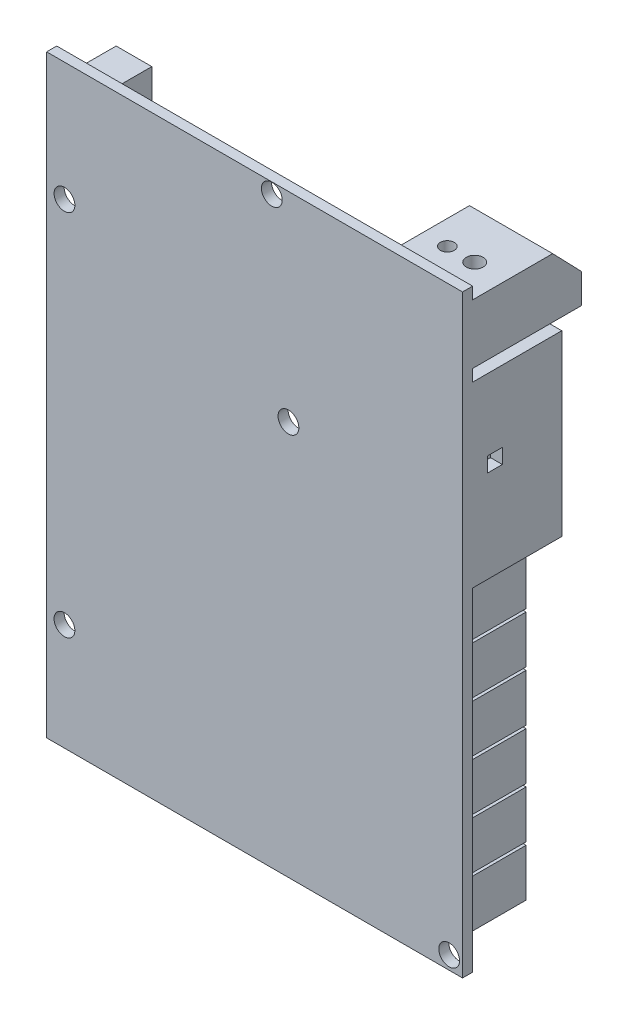
from build123d import *

# Parameters (mm, degrees)
SKETCH1_W                  = 70
SKETCH1_H                  = 100
BOSS_EXTRUDE1_DEPTH        = 1.7
SKETCH2_W                  = 6
SKETCH2_H                  = 8
BOSS_EXTRUDE2_DEPTH        = 10
SKETCH3_W                  = 5
SKETCH3_H                  = 7
CUT_EXTRUDE1_DEPTH         = 9.5
SKETCH4_W                  = 0.5
SKETCH4_H                  = 0.7
BOSS_EXTRUDE3_DEPTH        = 8.5
SKETCH5_W                  = 0.5
SKETCH5_H                  = 0.7
BOSS_EXTRUDE4_DEPTH        = 8.5
SKETCH6_W                  = 6
SKETCH6_H                  = 13
BOSS_EXTRUDE5_DEPTH        = 9
SKETCH7_W                  = 5
SKETCH7_H                  = 12
CUT_EXTRUDE2_DEPTH         = 8.5
SKETCH8_W                  = 0.5
SKETCH8_H                  = 0.7
BOSS_EXTRUDE6_DEPTH        = 7.5
SKETCH9_W                  = 0.5
SKETCH9_H                  = 0.7
BOSS_EXTRUDE7_DEPTH        = 7.5
SKETCH10_W                 = 0.5
SKETCH10_H                 = 0.7
BOSS_EXTRUDE8_DEPTH        = 7.5
SKETCH11_W                 = 0.5
SKETCH11_H                 = 0.7
BOSS_EXTRUDE9_DEPTH        = 7.5
SKETCH12_W                 = 6
SKETCH12_H                 = 8
BOSS_EXTRUDE10_DEPTH       = 10
SKETCH13_W                 = 5
SKETCH13_H                 = 7
CUT_EXTRUDE3_DEPTH         = 9.5
SKETCH14_W                 = 0.5
SKETCH14_H                 = 0.7
BOSS_EXTRUDE11_DEPTH       = 8.5
SKETCH15_W                 = 0.5
SKETCH15_H                 = 0.7
BOSS_EXTRUDE12_DEPTH       = 8.5
SKETCH16_W                 = 6
SKETCH16_H                 = 8
BOSS_EXTRUDE13_DEPTH       = 10
SKETCH17_W                 = 5
SKETCH17_H                 = 7
CUT_EXTRUDE4_DEPTH         = 9.5
SKETCH18_W                 = 0.5
SKETCH18_H                 = 0.7
BOSS_EXTRUDE14_DEPTH       = 8.5
SKETCH19_W                 = 0.5
SKETCH19_H                 = 0.7
BOSS_EXTRUDE15_DEPTH       = 8.5
SKETCH20_W                 = 6
SKETCH20_H                 = 13
BOSS_EXTRUDE16_DEPTH       = 9
SKETCH21_W                 = 5
SKETCH21_H                 = 12
CUT_EXTRUDE5_DEPTH         = 8.5
SKETCH22_W                 = 0.5
SKETCH22_H                 = 0.7
BOSS_EXTRUDE17_DEPTH       = 7.5
SKETCH23_W                 = 0.5
SKETCH23_H                 = 0.7
BOSS_EXTRUDE18_DEPTH       = 7.5
SKETCH24_W                 = 0.5
SKETCH24_H                 = 0.7
BOSS_EXTRUDE19_DEPTH       = 7.5
SKETCH25_W                 = 0.5
SKETCH25_H                 = 0.7
BOSS_EXTRUDE20_DEPTH       = 7.5
SKETCH26_W                 = 6
SKETCH26_H                 = 8
BOSS_EXTRUDE21_DEPTH       = 10
SKETCH27_W                 = 5
SKETCH27_H                 = 7
CUT_EXTRUDE6_DEPTH         = 9.5
SKETCH28_W                 = 0.5
SKETCH28_H                 = 0.7
BOSS_EXTRUDE22_DEPTH       = 8.5
SKETCH29_W                 = 0.5
SKETCH29_H                 = 0.7
BOSS_EXTRUDE23_DEPTH       = 8.5
SKETCH30_W                 = 6
SKETCH30_H                 = 8
BOSS_EXTRUDE24_DEPTH       = 10
SKETCH31_W                 = 5
SKETCH31_H                 = 7
CUT_EXTRUDE7_DEPTH         = 9.5
SKETCH32_W                 = 0.5
SKETCH32_H                 = 0.7
BOSS_EXTRUDE25_DEPTH       = 8.5
SKETCH33_W                 = 0.5
SKETCH33_H                 = 0.7
BOSS_EXTRUDE26_DEPTH       = 8.5
SKETCH34_W                 = 6
SKETCH34_H                 = 13
BOSS_EXTRUDE27_DEPTH       = 9
SKETCH35_W                 = 5
SKETCH35_H                 = 12
CUT_EXTRUDE8_DEPTH         = 8.5
SKETCH36_W                 = 0.5
SKETCH36_H                 = 0.7
BOSS_EXTRUDE28_DEPTH       = 7.5
SKETCH37_W                 = 0.5
SKETCH37_H                 = 0.7
BOSS_EXTRUDE29_DEPTH       = 7.5
SKETCH38_W                 = 0.5
SKETCH38_H                 = 0.7
BOSS_EXTRUDE30_DEPTH       = 7.5
SKETCH39_W                 = 0.5
SKETCH39_H                 = 0.7
BOSS_EXTRUDE31_DEPTH       = 7.5
SKETCH40_W                 = 6
SKETCH40_H                 = 8
BOSS_EXTRUDE32_DEPTH       = 10
SKETCH41_W                 = 5
SKETCH41_H                 = 7
CUT_EXTRUDE9_DEPTH         = 9.5
SKETCH42_W                 = 0.5
SKETCH42_H                 = 0.7
BOSS_EXTRUDE33_DEPTH       = 8.59367
SKETCH43_W                 = 0.5
SKETCH43_H                 = 0.7
BOSS_EXTRUDE34_DEPTH       = 8.59367
SKETCH44_W                 = 6
SKETCH44_H                 = 13
BOSS_EXTRUDE35_DEPTH       = 9
SKETCH45_W                 = 5
SKETCH45_H                 = 12
CUT_EXTRUDE10_DEPTH        = 8.5
SKETCH46_W                 = 0.5
SKETCH46_H                 = 0.7
BOSS_EXTRUDE36_DEPTH       = 7.5
SKETCH47_W                 = 0.5
SKETCH47_H                 = 0.7
BOSS_EXTRUDE37_DEPTH       = 7.5
SKETCH48_W                 = 0.5
SKETCH48_H                 = 0.7
BOSS_EXTRUDE38_DEPTH       = 7.5
SKETCH49_W                 = 0.5
SKETCH49_H                 = 0.7
BOSS_EXTRUDE39_DEPTH       = 7.5
SKETCH50_W                 = 6
SKETCH50_H                 = 8
BOSS_EXTRUDE40_DEPTH       = 10
SKETCH51_W                 = 5
SKETCH51_H                 = 7
CUT_EXTRUDE11_DEPTH        = 9.5
SKETCH52_W                 = 0.5
SKETCH52_H                 = 0.7
BOSS_EXTRUDE41_DEPTH       = 8.5
SKETCH53_W                 = 0.5
SKETCH53_H                 = 0.7
BOSS_EXTRUDE42_DEPTH       = 8.5
SKETCH54_W                 = 20
SKETCH54_H                 = 10
BOSS_EXTRUDE43_DEPTH       = 10
SKETCH55_W                 = 19
SKETCH55_H                 = 9
CUT_EXTRUDE12_DEPTH        = 9.5
SKETCH56_W                 = 0.5
SKETCH56_H                 = 0.7
BOSS_EXTRUDE44_DEPTH       = 8.59367
SKETCH57_W                 = 0.5
SKETCH57_H                 = 0.7
BOSS_EXTRUDE45_DEPTH       = 8.59367
SKETCH58_W                 = 0.5
SKETCH58_H                 = 0.7
BOSS_EXTRUDE46_DEPTH       = 8.59367
SKETCH59_W                 = 0.5
SKETCH59_H                 = 0.7
BOSS_EXTRUDE47_DEPTH       = 8.59367
SKETCH60_W                 = 0.5
SKETCH60_H                 = 0.7
BOSS_EXTRUDE48_DEPTH       = 8.59367
SKETCH61_W                 = 0.5
SKETCH61_H                 = 0.7
BOSS_EXTRUDE49_DEPTH       = 8.59367
SKETCH62_W                 = 0.5
SKETCH62_H                 = 0.7
BOSS_EXTRUDE50_DEPTH       = 8.59367
SKETCH63_W                 = 0.5
SKETCH63_H                 = 0.7
BOSS_EXTRUDE51_DEPTH       = 8.59367
SKETCH64_W                 = 0.5
SKETCH64_H                 = 0.7
BOSS_EXTRUDE52_DEPTH       = 8.59367
SKETCH65_W                 = 0.5
SKETCH65_H                 = 0.7
BOSS_EXTRUDE53_DEPTH       = 8.59367
SKETCH66_W                 = 8
SKETCH66_H                 = 10
BOSS_EXTRUDE54_DEPTH       = 4.1
SKETCH67_W                 = 7
SKETCH67_H                 = 2.6
CUT_EXTRUDE13_DEPTH        = 9.5
SKETCH68_W                 = 15
SKETCH68_H                 = 15
BOSS_EXTRUDE55_DEPTH       = 1.9
SKETCH69_W                 = 14
SKETCH69_H                 = 0.5
CUT_EXTRUDE14_DEPTH        = 14.5
BOSS_EXTRUDE56_DEPTH       = 14
SKETCH71_W                 = 10
SKETCH71_H                 = 30
BOSS_EXTRUDE57_DEPTH       = 15
SKETCH72_W                 = 2.5
SKETCH72_H                 = 2.5
CUT_EXTRUDE15_DEPTH        = 2
F_3_5_3_5_DIAMETER_HOLE1_D = 3.5
M2_CLEARANCE_HOLE1_D       = 2.347782271
M2_CLEARANCE_HOLE1_DEPTH   = 5
M2_5_CLEARANCE_HOLE1_D     = 2.850878472
M2_5_CLEARANCE_HOLE1_DEPTH = 5


with BuildPart() as part:
    # Sketch1 → Boss-Extrude1 (new body)
    with BuildSketch(Plane(origin=(0, 0, -40), x_dir=(-1, 0, 0), z_dir=(0, 0, -1))):
        with Locations((-16.2, -111.8)):
            Rectangle(SKETCH1_W, SKETCH1_H)
    extrude(amount=-BOSS_EXTRUDE1_DEPTH)

    # Sketch2 → Boss-Extrude2 (add)
    with BuildSketch(Plane(origin=(0, 0, -40), x_dir=(-1, 0, 0), z_dir=(0, 0, -1))):
        with Locations((-47.2, -110.3)):
            Rectangle(SKETCH2_W, SKETCH2_H)
    extrude(amount=BOSS_EXTRUDE2_DEPTH)

    # Sketch3 → Cut-Extrude1 (cut)
    with BuildSketch(Plane(origin=(0, 0, -50), x_dir=(-1, 0, 0), z_dir=(0, 0, -1))):
        with Locations((-47.2, -110.3)):
            Rectangle(SKETCH3_W, SKETCH3_H)
    extrude(amount=-CUT_EXTRUDE1_DEPTH, mode=Mode.SUBTRACT)

    # Sketch4 → Boss-Extrude3 (add)
    with BuildSketch(Plane(origin=(0, 0, -40.5), x_dir=(-1, 0, 0), z_dir=(0, 0, -1))):
        with Locations((-47.45, -111.9)):
            Rectangle(SKETCH4_W, SKETCH4_H)
    extrude(amount=BOSS_EXTRUDE3_DEPTH)

    # Sketch5 → Boss-Extrude4 (add)
    with BuildSketch(Plane(origin=(0, 0, -40.5), x_dir=(-1, 0, 0), z_dir=(0, 0, -1))):
        with Locations((-47.45, -108.7)):
            Rectangle(SKETCH5_W, SKETCH5_H)
    extrude(amount=BOSS_EXTRUDE4_DEPTH)

    # Sketch6 → Boss-Extrude5 (add)
    with BuildSketch(Plane(origin=(0, 0, -40), x_dir=(-1, 0, 0), z_dir=(0, 0, -1))):
        with Locations((14.8, -72.3)):
            Rectangle(SKETCH6_W, SKETCH6_H)
    extrude(amount=BOSS_EXTRUDE5_DEPTH)

    # Sketch7 → Cut-Extrude2 (cut)
    with BuildSketch(Plane(origin=(0, 0, -49), x_dir=(-1, 0, 0), z_dir=(0, 0, -1))):
        with Locations((14.8, -72.3)):
            Rectangle(SKETCH7_W, SKETCH7_H)
    extrude(amount=-CUT_EXTRUDE2_DEPTH, mode=Mode.SUBTRACT)

    # Sketch8 → Boss-Extrude6 (add)
    with BuildSketch(Plane(origin=(0, 0, -40.5), x_dir=(-1, 0, 0), z_dir=(0, 0, -1))):
        with Locations((14.55, -75.9)):
            Rectangle(SKETCH8_W, SKETCH8_H)
    extrude(amount=BOSS_EXTRUDE6_DEPTH)

    # Sketch9 → Boss-Extrude7 (add)
    with BuildSketch(Plane(origin=(0, 0, -40.5), x_dir=(-1, 0, 0), z_dir=(0, 0, -1))):
        with Locations((14.55, -68.4)):
            Rectangle(SKETCH9_W, SKETCH9_H)
    extrude(amount=BOSS_EXTRUDE7_DEPTH)

    # Sketch10 → Boss-Extrude8 (add)
    with BuildSketch(Plane(origin=(0, 0, -40.5), x_dir=(-1, 0, 0), z_dir=(0, 0, -1))):
        with Locations((14.55, -70.9)):
            Rectangle(SKETCH10_W, SKETCH10_H)
    extrude(amount=BOSS_EXTRUDE8_DEPTH)

    # Sketch11 → Boss-Extrude9 (add)
    with BuildSketch(Plane(origin=(0, 0, -40.5), x_dir=(-1, 0, 0), z_dir=(0, 0, -1))):
        with Locations((14.55, -73.4)):
            Rectangle(SKETCH11_W, SKETCH11_H)
    extrude(amount=BOSS_EXTRUDE9_DEPTH)

    # Sketch12 → Boss-Extrude10 (add)
    with BuildSketch(Plane(origin=(0, 0, -40), x_dir=(-1, 0, 0), z_dir=(0, 0, -1))):
        with Locations((-47.2, -135.8)):
            Rectangle(SKETCH12_W, SKETCH12_H)
    extrude(amount=BOSS_EXTRUDE10_DEPTH)

    # Sketch13 → Cut-Extrude3 (cut)
    with BuildSketch(Plane(origin=(0, 0, -50), x_dir=(-1, 0, 0), z_dir=(0, 0, -1))):
        with Locations((-47.2, -135.8)):
            Rectangle(SKETCH13_W, SKETCH13_H)
    extrude(amount=-CUT_EXTRUDE3_DEPTH, mode=Mode.SUBTRACT)

    # Sketch14 → Boss-Extrude11 (add)
    with BuildSketch(Plane(origin=(0, 0, -40.5), x_dir=(-1, 0, 0), z_dir=(0, 0, -1))):
        with Locations((-47.45, -134.2)):
            Rectangle(SKETCH14_W, SKETCH14_H)
    extrude(amount=BOSS_EXTRUDE11_DEPTH)

    # Sketch15 → Boss-Extrude12 (add)
    with BuildSketch(Plane(origin=(0, 0, -40.5), x_dir=(-1, 0, 0), z_dir=(0, 0, -1))):
        with Locations((-47.45, -137.4)):
            Rectangle(SKETCH15_W, SKETCH15_H)
    extrude(amount=BOSS_EXTRUDE12_DEPTH)

    # Sketch16 → Boss-Extrude13 (add)
    with BuildSketch(Plane(origin=(0, 0, -40), x_dir=(-1, 0, 0), z_dir=(0, 0, -1))):
        with Locations((-47.2, -127.3)):
            Rectangle(SKETCH16_W, SKETCH16_H)
    extrude(amount=BOSS_EXTRUDE13_DEPTH)

    # Sketch17 → Cut-Extrude4 (cut)
    with BuildSketch(Plane(origin=(0, 0, -50), x_dir=(-1, 0, 0), z_dir=(0, 0, -1))):
        with Locations((-47.2, -127.3)):
            Rectangle(SKETCH17_W, SKETCH17_H)
    extrude(amount=-CUT_EXTRUDE4_DEPTH, mode=Mode.SUBTRACT)

    # Sketch18 → Boss-Extrude14 (add)
    with BuildSketch(Plane(origin=(0, 0, -40.5), x_dir=(-1, 0, 0), z_dir=(0, 0, -1))):
        with Locations((-47.45, -125.7)):
            Rectangle(SKETCH18_W, SKETCH18_H)
    extrude(amount=BOSS_EXTRUDE14_DEPTH)

    # Sketch19 → Boss-Extrude15 (add)
    with BuildSketch(Plane(origin=(0, 0, -40.5), x_dir=(-1, 0, 0), z_dir=(0, 0, -1))):
        with Locations((-47.45, -128.9)):
            Rectangle(SKETCH19_W, SKETCH19_H)
    extrude(amount=BOSS_EXTRUDE15_DEPTH)

    # Sketch20 → Boss-Extrude16 (add)
    with BuildSketch(Plane(origin=(0, 0, -40), x_dir=(-1, 0, 0), z_dir=(0, 0, -1))):
        with Locations((14.8, -114.3)):
            Rectangle(SKETCH20_W, SKETCH20_H)
    extrude(amount=BOSS_EXTRUDE16_DEPTH)

    # Sketch21 → Cut-Extrude5 (cut)
    with BuildSketch(Plane(origin=(0, 0, -49), x_dir=(-1, 0, 0), z_dir=(0, 0, -1))):
        with Locations((14.8, -114.3)):
            Rectangle(SKETCH21_W, SKETCH21_H)
    extrude(amount=-CUT_EXTRUDE5_DEPTH, mode=Mode.SUBTRACT)

    # Sketch22 → Boss-Extrude17 (add)
    with BuildSketch(Plane(origin=(0, 0, -40.5), x_dir=(-1, 0, 0), z_dir=(0, 0, -1))):
        with Locations((14.55, -117.9)):
            Rectangle(SKETCH22_W, SKETCH22_H)
    extrude(amount=BOSS_EXTRUDE17_DEPTH)

    # Sketch23 → Boss-Extrude18 (add)
    with BuildSketch(Plane(origin=(0, 0, -40.5), x_dir=(-1, 0, 0), z_dir=(0, 0, -1))):
        with Locations((14.55, -115.4)):
            Rectangle(SKETCH23_W, SKETCH23_H)
    extrude(amount=BOSS_EXTRUDE18_DEPTH)

    # Sketch24 → Boss-Extrude19 (add)
    with BuildSketch(Plane(origin=(0, 0, -40.5), x_dir=(-1, 0, 0), z_dir=(0, 0, -1))):
        with Locations((14.55, -112.9)):
            Rectangle(SKETCH24_W, SKETCH24_H)
    extrude(amount=BOSS_EXTRUDE19_DEPTH)

    # Sketch25 → Boss-Extrude20 (add)
    with BuildSketch(Plane(origin=(0, 0, -40.5), x_dir=(-1, 0, 0), z_dir=(0, 0, -1))):
        with Locations((14.55, -110.4)):
            Rectangle(SKETCH25_W, SKETCH25_H)
    extrude(amount=BOSS_EXTRUDE20_DEPTH)

    # Sketch26 → Boss-Extrude21 (add)
    with BuildSketch(Plane(origin=(0, 0, -40), x_dir=(-1, 0, 0), z_dir=(0, 0, -1))):
        with Locations((-39.2, -113.3)):
            Rectangle(SKETCH26_W, SKETCH26_H)
    extrude(amount=BOSS_EXTRUDE21_DEPTH)

    # Sketch27 → Cut-Extrude6 (cut)
    with BuildSketch(Plane(origin=(0, 0, -50), x_dir=(-1, 0, 0), z_dir=(0, 0, -1))):
        with Locations((-39.2, -113.3)):
            Rectangle(SKETCH27_W, SKETCH27_H)
    extrude(amount=-CUT_EXTRUDE6_DEPTH, mode=Mode.SUBTRACT)

    # Sketch28 → Boss-Extrude22 (add)
    with BuildSketch(Plane(origin=(0, 0, -40.5), x_dir=(-1, 0, 0), z_dir=(0, 0, -1))):
        with Locations((-39.45, -111.7)):
            Rectangle(SKETCH28_W, SKETCH28_H)
    extrude(amount=BOSS_EXTRUDE22_DEPTH)

    # Sketch29 → Boss-Extrude23 (add)
    with BuildSketch(Plane(origin=(0, 0, -40.5), x_dir=(-1, 0, 0), z_dir=(0, 0, -1))):
        with Locations((-39.45, -114.9)):
            Rectangle(SKETCH29_W, SKETCH29_H)
    extrude(amount=BOSS_EXTRUDE23_DEPTH)

    # Sketch30 → Boss-Extrude24 (add)
    with BuildSketch(Plane(origin=(0, 0, -40), x_dir=(-1, 0, 0), z_dir=(0, 0, -1))):
        with Locations((-47.2, -144.3)):
            Rectangle(SKETCH30_W, SKETCH30_H)
    extrude(amount=BOSS_EXTRUDE24_DEPTH)

    # Sketch31 → Cut-Extrude7 (cut)
    with BuildSketch(Plane(origin=(0, 0, -50), x_dir=(-1, 0, 0), z_dir=(0, 0, -1))):
        with Locations((-47.2, -144.3)):
            Rectangle(SKETCH31_W, SKETCH31_H)
    extrude(amount=-CUT_EXTRUDE7_DEPTH, mode=Mode.SUBTRACT)

    # Sketch32 → Boss-Extrude25 (add)
    with BuildSketch(Plane(origin=(0, 0, -40.5), x_dir=(-1, 0, 0), z_dir=(0, 0, -1))):
        with Locations((-47.45, -142.7)):
            Rectangle(SKETCH32_W, SKETCH32_H)
    extrude(amount=BOSS_EXTRUDE25_DEPTH)

    # Sketch33 → Boss-Extrude26 (add)
    with BuildSketch(Plane(origin=(0, 0, -40.5), x_dir=(-1, 0, 0), z_dir=(0, 0, -1))):
        with Locations((-47.45, -145.9)):
            Rectangle(SKETCH33_W, SKETCH33_H)
    extrude(amount=BOSS_EXTRUDE26_DEPTH)

    # Sketch34 → Boss-Extrude27 (add)
    with BuildSketch(Plane(origin=(0, 0, -40), x_dir=(-1, 0, 0), z_dir=(0, 0, -1))):
        with Locations((14.8, -132.3)):
            Rectangle(SKETCH34_W, SKETCH34_H)
    extrude(amount=BOSS_EXTRUDE27_DEPTH)

    # Sketch35 → Cut-Extrude8 (cut)
    with BuildSketch(Plane(origin=(0, 0, -49), x_dir=(-1, 0, 0), z_dir=(0, 0, -1))):
        with Locations((14.8, -132.3)):
            Rectangle(SKETCH35_W, SKETCH35_H)
    extrude(amount=-CUT_EXTRUDE8_DEPTH, mode=Mode.SUBTRACT)

    # Sketch36 → Boss-Extrude28 (add)
    with BuildSketch(Plane(origin=(0, 0, -40.5), x_dir=(-1, 0, 0), z_dir=(0, 0, -1))):
        with Locations((14.55, -128.4)):
            Rectangle(SKETCH36_W, SKETCH36_H)
    extrude(amount=BOSS_EXTRUDE28_DEPTH)

    # Sketch37 → Boss-Extrude29 (add)
    with BuildSketch(Plane(origin=(0, 0, -40.5), x_dir=(-1, 0, 0), z_dir=(0, 0, -1))):
        with Locations((14.55, -135.9)):
            Rectangle(SKETCH37_W, SKETCH37_H)
    extrude(amount=BOSS_EXTRUDE29_DEPTH)

    # Sketch38 → Boss-Extrude30 (add)
    with BuildSketch(Plane(origin=(0, 0, -40.5), x_dir=(-1, 0, 0), z_dir=(0, 0, -1))):
        with Locations((14.55, -133.4)):
            Rectangle(SKETCH38_W, SKETCH38_H)
    extrude(amount=BOSS_EXTRUDE30_DEPTH)

    # Sketch39 → Boss-Extrude31 (add)
    with BuildSketch(Plane(origin=(0, 0, -40.5), x_dir=(-1, 0, 0), z_dir=(0, 0, -1))):
        with Locations((14.55, -130.9)):
            Rectangle(SKETCH39_W, SKETCH39_H)
    extrude(amount=BOSS_EXTRUDE31_DEPTH)

    # Sketch40 → Boss-Extrude32 (add)
    with BuildSketch(Plane(origin=(0, 0, -40), x_dir=(-1, 0, 0), z_dir=(0, 0, -1))):
        with Locations((-47.2, -152.8)):
            Rectangle(SKETCH40_W, SKETCH40_H)
    extrude(amount=BOSS_EXTRUDE32_DEPTH)

    # Sketch41 → Cut-Extrude9 (cut)
    with BuildSketch(Plane(origin=(0, 0, -50), x_dir=(-1, 0, 0), z_dir=(0, 0, -1))):
        with Locations((-47.2, -152.8)):
            Rectangle(SKETCH41_W, SKETCH41_H)
    extrude(amount=-CUT_EXTRUDE9_DEPTH, mode=Mode.SUBTRACT)

    # Sketch42 → Boss-Extrude33 (add)
    with BuildSketch(Plane(origin=(0, 0, -40.5), x_dir=(-1, 0, 0), z_dir=(0, 0, -1))):
        with Locations((-47.45, -154.4)):
            Rectangle(SKETCH42_W, SKETCH42_H)
    extrude(amount=BOSS_EXTRUDE33_DEPTH)

    # Sketch43 → Boss-Extrude34 (add)
    with BuildSketch(Plane(origin=(0, 0, -40.5), x_dir=(-1, 0, 0), z_dir=(0, 0, -1))):
        with Locations((-47.45, -151.2)):
            Rectangle(SKETCH43_W, SKETCH43_H)
    extrude(amount=BOSS_EXTRUDE34_DEPTH)

    # Sketch44 → Boss-Extrude35 (add)
    with BuildSketch(Plane(origin=(0, 0, -40), x_dir=(-1, 0, 0), z_dir=(0, 0, -1))):
        with Locations((14.8, -93.3)):
            Rectangle(SKETCH44_W, SKETCH44_H)
    extrude(amount=BOSS_EXTRUDE35_DEPTH)

    # Sketch45 → Cut-Extrude10 (cut)
    with BuildSketch(Plane(origin=(0, 0, -49), x_dir=(-1, 0, 0), z_dir=(0, 0, -1))):
        with Locations((14.8, -93.3)):
            Rectangle(SKETCH45_W, SKETCH45_H)
    extrude(amount=-CUT_EXTRUDE10_DEPTH, mode=Mode.SUBTRACT)

    # Sketch46 → Boss-Extrude36 (add)
    with BuildSketch(Plane(origin=(0, 0, -40.5), x_dir=(-1, 0, 0), z_dir=(0, 0, -1))):
        with Locations((14.55, -96.9)):
            Rectangle(SKETCH46_W, SKETCH46_H)
    extrude(amount=BOSS_EXTRUDE36_DEPTH)

    # Sketch47 → Boss-Extrude37 (add)
    with BuildSketch(Plane(origin=(0, 0, -40.5), x_dir=(-1, 0, 0), z_dir=(0, 0, -1))):
        with Locations((14.55, -94.4)):
            Rectangle(SKETCH47_W, SKETCH47_H)
    extrude(amount=BOSS_EXTRUDE37_DEPTH)

    # Sketch48 → Boss-Extrude38 (add)
    with BuildSketch(Plane(origin=(0, 0, -40.5), x_dir=(-1, 0, 0), z_dir=(0, 0, -1))):
        with Locations((14.55, -89.4)):
            Rectangle(SKETCH48_W, SKETCH48_H)
    extrude(amount=BOSS_EXTRUDE38_DEPTH)

    # Sketch49 → Boss-Extrude39 (add)
    with BuildSketch(Plane(origin=(0, 0, -40.5), x_dir=(-1, 0, 0), z_dir=(0, 0, -1))):
        with Locations((14.55, -91.9)):
            Rectangle(SKETCH49_W, SKETCH49_H)
    extrude(amount=BOSS_EXTRUDE39_DEPTH)

    # Sketch50 → Boss-Extrude40 (add)
    with BuildSketch(Plane(origin=(0, 0, -40), x_dir=(-1, 0, 0), z_dir=(0, 0, -1))):
        with Locations((-47.2, -118.8)):
            Rectangle(SKETCH50_W, SKETCH50_H)
    extrude(amount=BOSS_EXTRUDE40_DEPTH)

    # Sketch51 → Cut-Extrude11 (cut)
    with BuildSketch(Plane(origin=(0, 0, -50), x_dir=(-1, 0, 0), z_dir=(0, 0, -1))):
        with Locations((-47.2, -118.8)):
            Rectangle(SKETCH51_W, SKETCH51_H)
    extrude(amount=-CUT_EXTRUDE11_DEPTH, mode=Mode.SUBTRACT)

    # Sketch52 → Boss-Extrude41 (add)
    with BuildSketch(Plane(origin=(0, 0, -40.5), x_dir=(-1, 0, 0), z_dir=(0, 0, -1))):
        with Locations((-47.45, -117.2)):
            Rectangle(SKETCH52_W, SKETCH52_H)
    extrude(amount=BOSS_EXTRUDE41_DEPTH)

    # Sketch53 → Boss-Extrude42 (add)
    with BuildSketch(Plane(origin=(0, 0, -40.5), x_dir=(-1, 0, 0), z_dir=(0, 0, -1))):
        with Locations((-47.45, -120.4)):
            Rectangle(SKETCH53_W, SKETCH53_H)
    extrude(amount=BOSS_EXTRUDE42_DEPTH)

    # Sketch54 → Boss-Extrude43 (add)
    with BuildSketch(Plane(origin=(0, 0, -40), x_dir=(-1, 0, 0), z_dir=(0, 0, -1))):
        with Locations((-33.7, -156.8)):
            Rectangle(SKETCH54_W, SKETCH54_H)
    extrude(amount=BOSS_EXTRUDE43_DEPTH)

    # Sketch55 → Cut-Extrude12 (cut)
    with BuildSketch(Plane(origin=(0, 0, -50), x_dir=(-1, 0, 0), z_dir=(0, 0, -1))):
        with Locations((-33.7, -156.8)):
            Rectangle(SKETCH55_W, SKETCH55_H)
    extrude(amount=-CUT_EXTRUDE12_DEPTH, mode=Mode.SUBTRACT)

    # Sketch56 → Boss-Extrude44 (add)
    with BuildSketch(Plane(origin=(0, 0, -40.5), x_dir=(-1, 0, 0), z_dir=(0, 0, -1))):
        with Locations((-36.95, -155.2)):
            Rectangle(SKETCH56_W, SKETCH56_H)
    extrude(amount=BOSS_EXTRUDE44_DEPTH)

    # Sketch57 → Boss-Extrude45 (add)
    with BuildSketch(Plane(origin=(0, 0, -40.5), x_dir=(-1, 0, 0), z_dir=(0, 0, -1))):
        with Locations((-27.95, -155.2)):
            Rectangle(SKETCH57_W, SKETCH57_H)
    extrude(amount=BOSS_EXTRUDE45_DEPTH)

    # Sketch58 → Boss-Extrude46 (add)
    with BuildSketch(Plane(origin=(0, 0, -40.5), x_dir=(-1, 0, 0), z_dir=(0, 0, -1))):
        with Locations((-27.95, -158.4)):
            Rectangle(SKETCH58_W, SKETCH58_H)
    extrude(amount=BOSS_EXTRUDE46_DEPTH)

    # Sketch59 → Boss-Extrude47 (add)
    with BuildSketch(Plane(origin=(0, 0, -40.5), x_dir=(-1, 0, 0), z_dir=(0, 0, -1))):
        with Locations((-36.95, -158.4)):
            Rectangle(SKETCH59_W, SKETCH59_H)
    extrude(amount=BOSS_EXTRUDE47_DEPTH)

    # Sketch60 → Boss-Extrude48 (add)
    with BuildSketch(Plane(origin=(0, 0, -40.5), x_dir=(-1, 0, 0), z_dir=(0, 0, -1))):
        with Locations((-30.95, -158.4)):
            Rectangle(SKETCH60_W, SKETCH60_H)
    extrude(amount=BOSS_EXTRUDE48_DEPTH)

    # Sketch61 → Boss-Extrude49 (add)
    with BuildSketch(Plane(origin=(0, 0, -40.5), x_dir=(-1, 0, 0), z_dir=(0, 0, -1))):
        with Locations((-39.95, -155.2)):
            Rectangle(SKETCH61_W, SKETCH61_H)
    extrude(amount=BOSS_EXTRUDE49_DEPTH)

    # Sketch62 → Boss-Extrude50 (add)
    with BuildSketch(Plane(origin=(0, 0, -40.5), x_dir=(-1, 0, 0), z_dir=(0, 0, -1))):
        with Locations((-33.95, -158.4)):
            Rectangle(SKETCH62_W, SKETCH62_H)
    extrude(amount=BOSS_EXTRUDE50_DEPTH)

    # Sketch63 → Boss-Extrude51 (add)
    with BuildSketch(Plane(origin=(0, 0, -40.5), x_dir=(-1, 0, 0), z_dir=(0, 0, -1))):
        with Locations((-30.95, -155.2)):
            Rectangle(SKETCH63_W, SKETCH63_H)
    extrude(amount=BOSS_EXTRUDE51_DEPTH)

    # Sketch64 → Boss-Extrude52 (add)
    with BuildSketch(Plane(origin=(0, 0, -40.5), x_dir=(-1, 0, 0), z_dir=(0, 0, -1))):
        with Locations((-33.95, -155.2)):
            Rectangle(SKETCH64_W, SKETCH64_H)
    extrude(amount=BOSS_EXTRUDE52_DEPTH)

    # Sketch65 → Boss-Extrude53 (add)
    with BuildSketch(Plane(origin=(0, 0, -40.5), x_dir=(-1, 0, 0), z_dir=(0, 0, -1))):
        with Locations((-39.95, -158.4)):
            Rectangle(SKETCH65_W, SKETCH65_H)
    extrude(amount=BOSS_EXTRUDE53_DEPTH)

    # Sketch66 → Boss-Extrude54 (add)
    with BuildSketch(Plane(origin=(0, 0, -40), x_dir=(-1, 0, 0), z_dir=(0, 0, -1))):
        with Locations((-7.5, -156.8)):
            Rectangle(SKETCH66_W, SKETCH66_H)
    extrude(amount=BOSS_EXTRUDE54_DEPTH)

    # Sketch67 → Cut-Extrude13 (cut)
    with BuildSketch(Plane.XZ.offset(161.8)):
        with Locations((7.5, -41.8)):
            Rectangle(SKETCH67_W, SKETCH67_H)
    extrude(amount=-CUT_EXTRUDE13_DEPTH, mode=Mode.SUBTRACT)

    # Sketch68 → Boss-Extrude55 (add)
    with BuildSketch(Plane(origin=(0, 0, -40), x_dir=(-1, 0, 0), z_dir=(0, 0, -1))):
        with Locations((8.8, -154.3)):
            Rectangle(SKETCH68_W, SKETCH68_H)
    extrude(amount=BOSS_EXTRUDE55_DEPTH)

    # Sketch69 → Cut-Extrude14 (cut)
    with BuildSketch(Plane.XZ.offset(161.8)):
        with Locations((-8.8, -40.75)):
            Rectangle(SKETCH69_W, SKETCH69_H)
    extrude(amount=-CUT_EXTRUDE14_DEPTH, mode=Mode.SUBTRACT)

    # Sketch70 → Boss-Extrude56 (add)
    with BuildSketch(Plane(origin=(51.2, 0, 0), x_dir=(0, 0, -1), z_dir=(1, 0, 0))):
        Polygon((40, -73.8), (58.3, -73.8), (58.3, -68.8), (53.471556126, -63.8), (40, -63.8), align=None)
    extrude(amount=-BOSS_EXTRUDE56_DEPTH)

    # Sketch71 → Boss-Extrude57 (add)
    with BuildSketch(Plane(origin=(0, 0, -40), x_dir=(-1, 0, 0), z_dir=(0, 0, -1))):
        with Locations((-46.2, -90.8)):
            Rectangle(SKETCH71_W, SKETCH71_H)
    extrude(amount=BOSS_EXTRUDE57_DEPTH)

    # Sketch72 → Cut-Extrude15 (cut)
    with BuildSketch(Plane(origin=(51.2, 0, 0), x_dir=(0, 0, -1), z_dir=(1, 0, 0))):
        with Locations((43.7500125, -89.05)):
            Rectangle(SKETCH72_W, SKETCH72_H)
    extrude(amount=-CUT_EXTRUDE15_DEPTH, mode=Mode.SUBTRACT)

    # Ø3.5 (3.5) Diameter Hole1 (through all)
    with Locations(Plane(origin=(0, 0, -40), x_dir=(-1, 0, 0), z_dir=(0, 0, -1))):
        with Locations((-48.95, -159.55), (15.8, -81.8), (15.8, -143.8), (-21.9, -95.4), (-19.1, -63.6)):
            Hole(F_3_5_3_5_DIAMETER_HOLE1_D / 2)

    # M2 Clearance Hole1
    with Locations(Plane(origin=(0, -63.8, 0), x_dir=(1, 0, 0), z_dir=(0, 1, 0))):
        with Locations((41.270960678, 45.665229062)):
            Hole(M2_CLEARANCE_HOLE1_D / 2, depth=M2_CLEARANCE_HOLE1_DEPTH)

    # M2.5 Clearance Hole1
    with Locations(Plane(origin=(0, -63.8, 0), x_dir=(1, 0, 0), z_dir=(0, 1, 0))):
        with Locations((45.882675853, 45.665229062)):
            Hole(M2_5_CLEARANCE_HOLE1_D / 2, depth=M2_5_CLEARANCE_HOLE1_DEPTH)


solid = part.part
